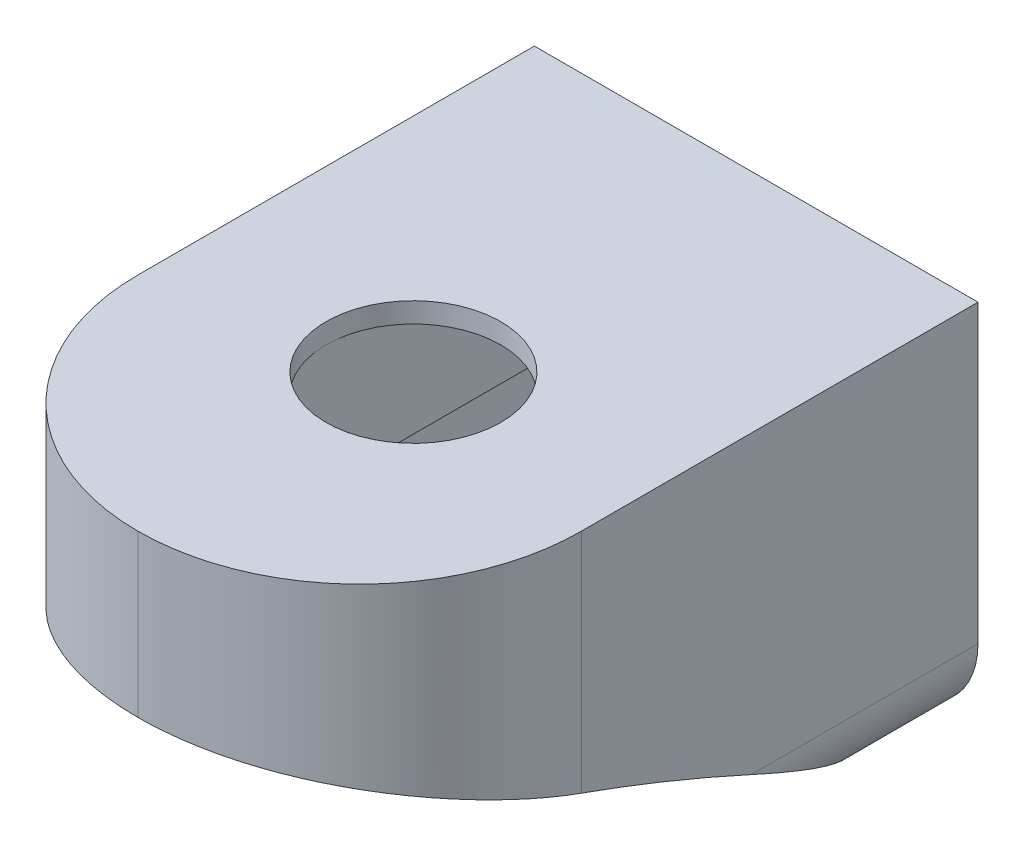
from build123d import *

# Parameters (mm, degrees)
SKETCH1_W           = 33
SKETCH1_H           = 28
BOSS_EXTRUDE1_DEPTH = 46
CUT_EXTRUDE1_DEPTH  = 59.318093247
CUT_EXTRUDE2_START  = -3
CUT_EXTRUDE2_DEPTH  = 27
FILLET1_R           = 12.5
FILLET2_R           = 16.5
FILLET3_R           = 6
SKETCH5_W           = 13
SKETCH5_H           = 23
CUT_EXTRUDE3_DEPTH  = 9
SKETCH6_R           = 6.5
CUT_EXTRUDE5_DEPTH  = 56.592265809
SKETCH7_R           = 1
CUT_EXTRUDE6_DEPTH  = 8
SKETCH8_R           = 1.3
SKETCH8_R_2         = 2.5
CUT_EXTRUDE7_DEPTH  = 2.5


with BuildPart() as part:
    # Sketch1 → Boss-Extrude1 (new body)
    with BuildSketch(Plane.XY):
        Rectangle(SKETCH1_W, SKETCH1_H)
    extrude(amount=BOSS_EXTRUDE1_DEPTH)

    # Sketch3 → Cut-Extrude1 (cut, through all)
    with BuildSketch(Plane(origin=(16.5, 0, 0), x_dir=(0, 0, -1), z_dir=(1, 0, 0))):
        with BuildLine():
            Line((-5, -14), (-46, -14))
            Line((-46, -14), (-46, 2))
            add(Edge.make_bspline(
                [(-46, 2), (-24.590873565, -3.089136006), (-5, -14)],
                knots=[0, 0, 0, 1, 1, 1], degree=2))
        make_face()
    extrude(amount=-CUT_EXTRUDE1_DEPTH, mode=Mode.SUBTRACT)

    # Sketch4 → Cut-Extrude2 (cut)
    with BuildSketch(Plane(origin=(16.5, 0, 0), x_dir=(0, 0, -1), z_dir=(1, 0, 0)).offset(CUT_EXTRUDE2_START)):
        with BuildLine():
            Line((-5, -14), (-2.5, -14))
            Line((-2.5, -14), (-2.5, 3.5))
            Line((-2.5, 3.5), (-40.5, 3.5))
            Line((-40.5, 3.5), (-40.5, 0.588274649))
            add(Edge.make_bspline(
                [(-5, -14), (-22.060550055, -4.498364419), (-40.5, 0.588274649)],
                knots=[0, 0, 0, 1, 1, 1], degree=2))
        make_face()
    extrude(amount=-CUT_EXTRUDE2_DEPTH, mode=Mode.SUBTRACT)

    # Fillet1
    fillet1_edges = [part.edges().sort_by_distance(p)[0] for p in [
        (13.5, 2.044137325, 40.5),
        (-13.5, 2.044137325, 40.5),
    ]]
    fillet(fillet1_edges, radius=FILLET1_R)

    # Fillet2
    fillet2_edges = [part.edges().sort_by_distance(p)[0] for p in [
        (16.5, 8, 46),
        (-16.5, 8, 46),
    ]]
    fillet(fillet2_edges, radius=FILLET2_R - 0.0001)  # a hair under: the kernel refuses the full size

    # Fillet3
    fillet3_edges = [part.edges().sort_by_distance(p)[0] for p in [
        (-16.5, -14, 2.5),
        (16.5, -14, 2.5),
    ]]
    fillet(fillet3_edges, radius=FILLET3_R)

    # Sketch5 → Cut-Extrude3 (cut)
    with BuildSketch(Plane.XZ.offset(-3.5)):
        with Locations((0, 20.5)):
            Rectangle(SKETCH5_W, SKETCH5_H)
    extrude(amount=-CUT_EXTRUDE3_DEPTH, mode=Mode.SUBTRACT)

    # Sketch6 → Cut-Extrude5 (cut, through all)
    with BuildSketch(Plane.XZ.offset(-12.5)):
        with Locations((0, 25.5)):
            Circle(SKETCH6_R)
    extrude(amount=-CUT_EXTRUDE5_DEPTH, mode=Mode.SUBTRACT)

    # Sketch7 → Cut-Extrude6 (cut)
    with BuildSketch(Plane.XZ.offset(-3.5)):
        with Locations((0, 34.3)):
            Circle(SKETCH7_R)
        with Locations((0, 6.7)):
            Circle(SKETCH7_R)
    extrude(amount=-CUT_EXTRUDE6_DEPTH, mode=Mode.SUBTRACT)

    # Sketch8 → Cut-Extrude7 (cut)
    with BuildSketch(Plane(origin=(0, 0, 0), x_dir=(-1, 0, 0), z_dir=(0, 0, -1))):
        with Locations((-9.5, 0)):
            Circle(SKETCH8_R)
        with Locations((-5, 0)):
            Circle(SKETCH8_R_2)
        with Locations((-0.5, 0)):
            Circle(SKETCH8_R)
    extrude(amount=-CUT_EXTRUDE7_DEPTH, mode=Mode.SUBTRACT)


solid = part.part
